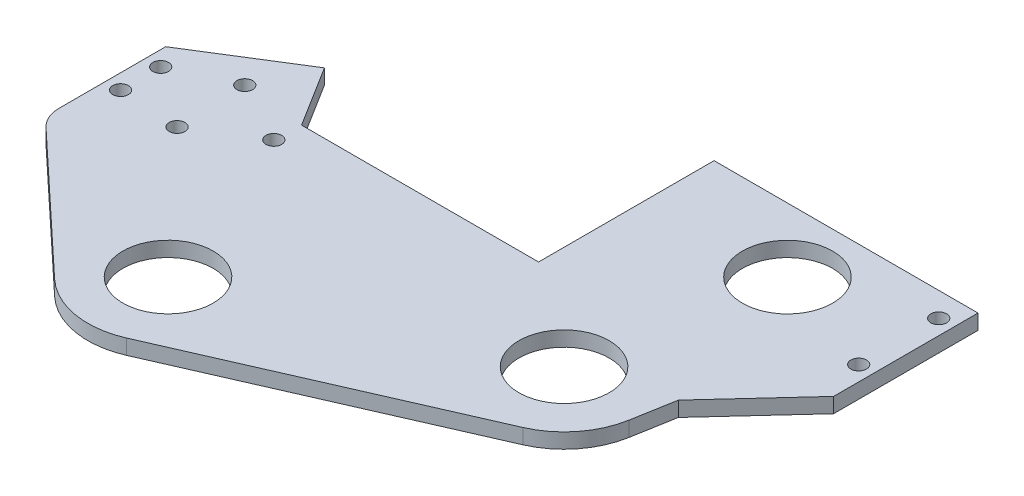
from build123d import *

# Parameters (mm, degrees)
SKETCH1_R              = 14.29004
BOSS_EXTRUDE1_DEPTH    = 4.7625
FILLET1_R              = 10
F_10_CLEARANCE_HOLE1_D = 4.9784
F_10_CLEARANCE_HOLE2_D = 4.9784


with BuildPart() as part:
    # Sketch1 → Boss-Extrude1 (new body)
    with BuildSketch(Plane(origin=(0, 0, 0), x_dir=(1, 0, 0), z_dir=(0, 1, 0))):
        with BuildLine():
            Line((-62.06952, -79.895280222), (25.163028109, -41.695780276))
            ThreePointArc((25.163028109, -41.695780276), (34.911191298, -34.148496119), (39.936134607, -22.890693115))
            Line((39.936134607, -22.890693115), (42.271095404, -9.586739751))
            Line((42.271095404, -9.586739751), (65.82695514, 16.012754812))
            Line((65.82695514, 16.012754812), (65.826833771, 61.726825209))
            Line((65.826833771, 61.726825209), (-17.734439664, 61.726825209))
            Line((-17.734439664, 61.726825209), (-17.734439664, 6.164335762))
            Line((-17.734439664, 6.164335762), (-92.776174625, 6.164335762))
            Line((-92.776174625, 6.164335762), (-104.853858759, 25.492670713))
            Line((-104.853858759, 25.492670713), (-135.78566057, 6.164335762))
            Line((-135.78566057, 6.164335762), (-135.78566057, -31.935664238))
            Line((-135.78566057, -31.935664238), (-89.620113812, -75.16814328))
            ThreePointArc((-89.620113812, -75.16814328), (-76.553580444, -81.662511553), (-62.06952, -79.895280222))
        make_face()
        with Locations((25.821833771, 41.412625209)):
            Circle(SKETCH1_R, mode=Mode.SUBTRACT)
        with Locations((15.012562201, -18.516537909)):
            Circle(SKETCH1_R, mode=Mode.SUBTRACT)
        with Locations((-72.258332946, -56.628468385)):
            Circle(SKETCH1_R, mode=Mode.SUBTRACT)
    extrude(amount=BOSS_EXTRUDE1_DEPTH)

    # Fillet1
    fillet1_edges = [part.edges().sort_by_distance(p)[0] for p in [
        (-135.78566057, 2.38125, 31.935664238),
    ]]
    fillet(fillet1_edges, radius=FILLET1_R)

    # #10 Clearance Hole1 (through all)
    with Locations(Plane(origin=(0, 4.7625, 0), x_dir=(1, 0, 0), z_dir=(0, 1, 0))):
        with Locations((61.064354133, 54.057452946), (61.064421422, 28.712718776), (-131.02316057, -0.185664238), (-131.02316057, -12.885664238)):
            Hole(F_10_CLEARANCE_HOLE1_D / 2)

    # #10 Clearance Hole2 (through all)
    with Locations(Plane(origin=(0, 4.7625, 0), x_dir=(1, 0, 0), z_dir=(0, 1, 0))):
        with Locations((-111.967153366, -14.051247514), (-93.119284429, -2.273791866), (-112.732400526, 8.143579493)):
            Hole(F_10_CLEARANCE_HOLE2_D / 2)


solid = part.part
